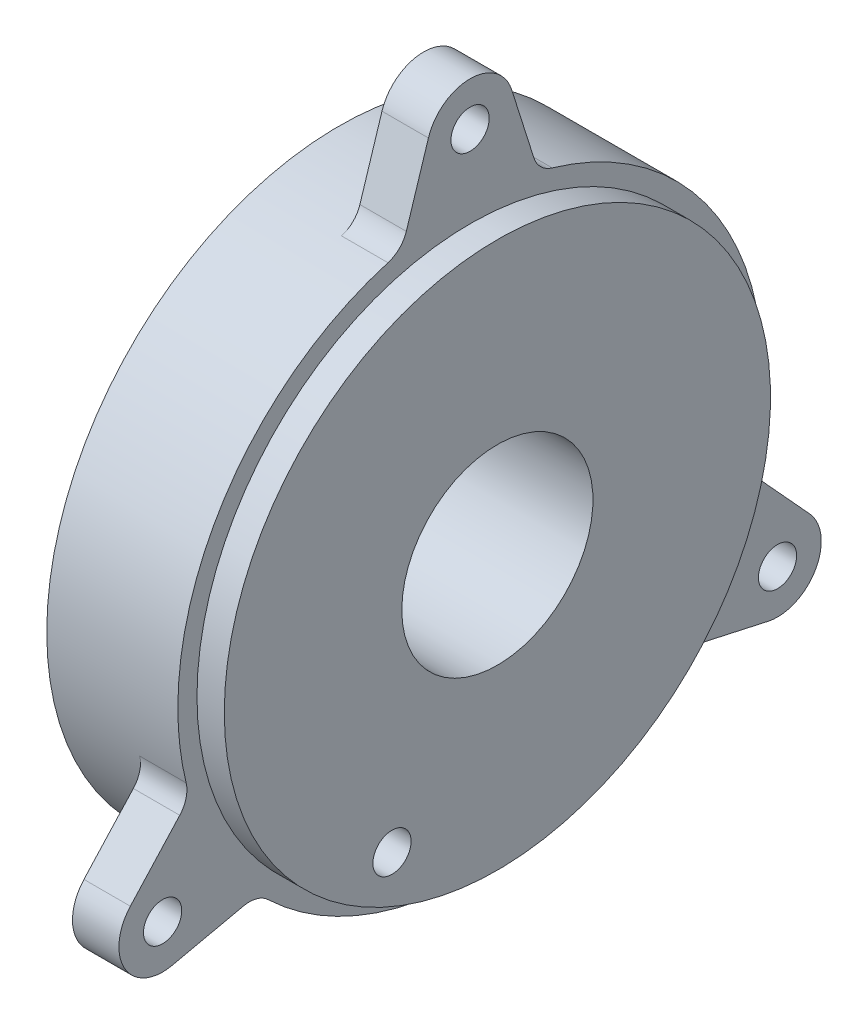
from build123d import *

# Parameters (mm, degrees)
EXTRUS_O1_START          = -8.5
EXTRUS_O1_OUTLINE_R      = 3.5
EXTRUS_O1_DEPTH          = 8.5
FILETE1_R                = 5
CIRPATTERN1_COUNT        = 3
FILETE1_OF_CIRPATTERN1_R = 5
ESBO_O3_R                = 48.5
ESBO_O3_R_2              = 22.5
CORTE_EXTRUS_O1_DEPTH    = 21
ESBO_O4_R                = 3.5
CORTE_EXTRUS_O2_DEPTH    = 102.505753245


# Read off the part's stored shape, not the designer's step: Extrusão1
with BuildPart() as part:
    # Esboço1 → Revolução1 (revolve)
    with BuildSketch(Plane.XY, mode=Mode.PRIVATE) as revolu_o1_sk:
        Polygon((0, 17.5), (29, 17.5), (29, 50), (24, 50), (24, 53.5), (0, 53.5), align=None)
    revolve(revolu_o1_sk.sketch.rotate(Axis((0, 0, 0), (1, 0, 0)), 90), axis=Axis((0, 0, 0), (1, 0, 0)))

    # Extrusão1 outline → Extrusão1 (add)
    with BuildSketch(Plane(origin=(24, 0, 0), x_dir=(0, 0, -1), z_dir=(1, 0, 0)).offset(EXTRUS_O1_START)):
        with BuildLine():
            Line((-7.627068165, 67.414164927), (-12.499978821, 52.019232304))
            ThreePointArc((-12.499978821, 52.019232304), (1.2458e-05, 53.5), (12.500003048, 52.019226482))
            Line((12.500003048, 52.019226482), (7.627010883, 67.414196325))
            ThreePointArc((7.627010883, 67.414196325), (-4.0138e-05, 73), (-7.627068165, 67.414164927))
        make_face()
        with Locations((-2.3672e-05, 65)):
            Circle(EXTRUS_O1_OUTLINE_R, mode=Mode.SUBTRACT)
    extrus_o1 = extrude(amount=EXTRUS_O1_DEPTH)

    # Filete1
    filete1_edges = [part.edges().sort_by_distance(p)[0] for p in [
        (19.75, 52.019232304, 12.499978821),
        (19.75, 52.019226482, -12.500003048),
    ]]
    fillet(filete1_edges, radius=FILETE1_R)

    # CirPattern1: Extrusão1 ×3 about axis
    cirpattern1_axis = Axis((0, 0, 0), (1, 0, 0))
    for i in range(1, CIRPATTERN1_COUNT):
        add(extrus_o1.rotate(cirpattern1_axis, i * 360 / CIRPATTERN1_COUNT))

    # Filete1 of CirPattern1
    filete1_of_cirpattern1_edges = [part.edges().sort_by_distance(p)[0] for p in [
        (19.75, -36.834915358, 38.79998725),
        (19.75, -15.184293054, 51.299973143),
        (19.75, -15.184316946, -51.299966071),
        (19.75, -36.834933428, -38.799970095),
    ]]
    fillet(filete1_of_cirpattern1_edges, radius=FILETE1_OF_CIRPATTERN1_R)

    # Esboço3 → Corte-extrusão1 (cut)
    with BuildSketch(Plane.ZY):
        Circle(ESBO_O3_R)
        Circle(ESBO_O3_R_2, mode=Mode.SUBTRACT)
    extrude(amount=-CORTE_EXTRUS_O1_DEPTH, mode=Mode.SUBTRACT)

    # Esboço4 → Corte-extrusão2 (cut, through all)
    with BuildSketch(Plane(origin=(29, 0, 0), x_dir=(0, 0, -1), z_dir=(1, 0, 0))):
        with Locations((-19.29163941, -37.5000205)):
            Circle(ESBO_O4_R)
    extrude(amount=-CORTE_EXTRUS_O2_DEPTH, mode=Mode.SUBTRACT)


solid = part.part
